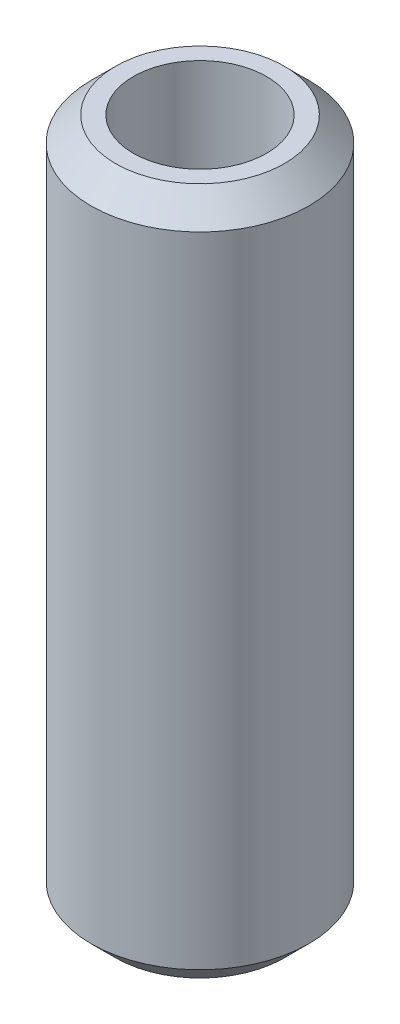
from build123d import *

# Parameters (mm, degrees)
SKETCH1_R           = 7.5
BOSS_EXTRUDE1_DEPTH = 47.392952635
SKETCH2_R           = 4.588613185
CUT_EXTRUDE1_DEPTH  = 49.565337016
CHAMFER1_SIZE       = 1.684619386


with BuildPart() as part:
    # Sketch1 → Boss-Extrude1 (new body)
    with BuildSketch(Plane(origin=(0, 0, 0), x_dir=(1, 0, 0), z_dir=(0, 1, 0))):
        Circle(SKETCH1_R)
    extrude(amount=BOSS_EXTRUDE1_DEPTH)

    # Sketch2 → Cut-Extrude1 (cut, through all)
    with BuildSketch(Plane(origin=(0, 0, 0), x_dir=(1, 0, 0), z_dir=(0, 1, 0))):
        Circle(SKETCH2_R)
    extrude(amount=CUT_EXTRUDE1_DEPTH, mode=Mode.SUBTRACT)

    # Chamfer1
    chamfer1_edges = [part.edges().sort_by_distance(p)[0] for p in [
        (-7.5, 47.392952635, 0),
        (-7.5, 0, 0),
    ]]
    chamfer(chamfer1_edges, length=CHAMFER1_SIZE)


solid = part.part
